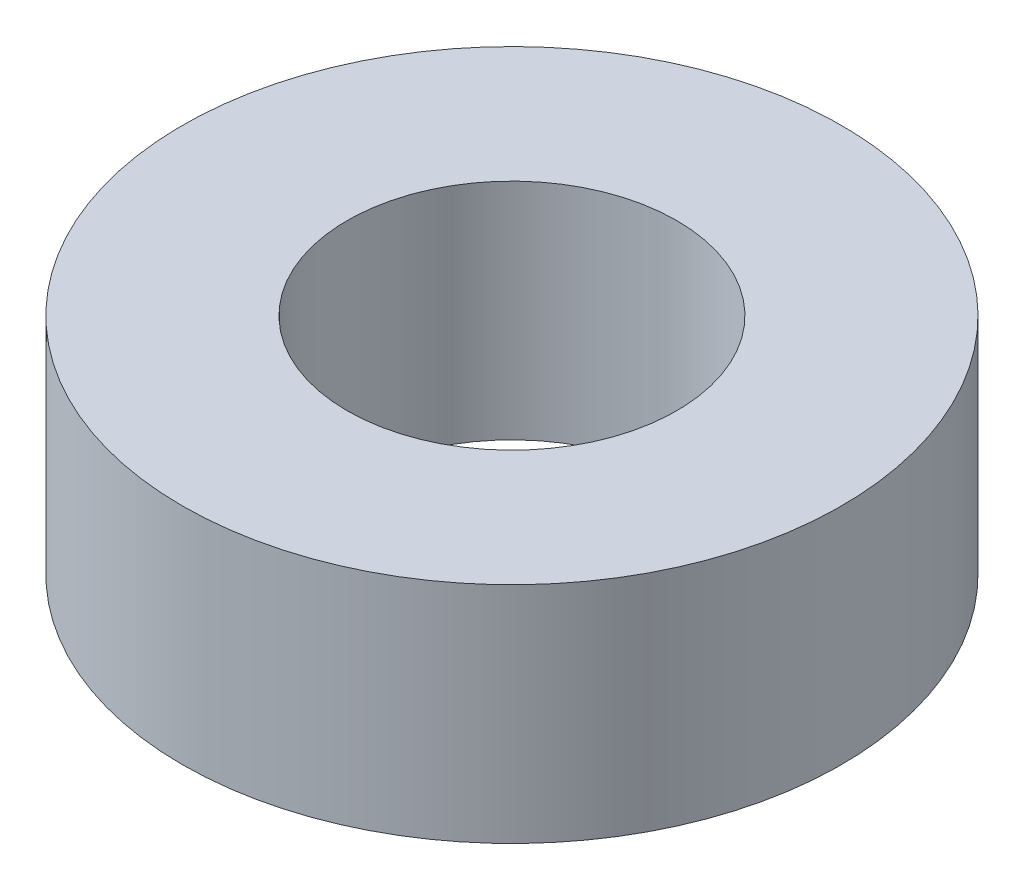
from build123d import *

# Parameters (mm, degrees)
SKETCH1_R           = 25
BOSS_EXTRUDE1_DEPTH = 17
SKETCH2_R           = 12.5
CUT_EXTRUDE1_DEPTH  = 40.230090492


with BuildPart() as part:
    # Sketch1 → Boss-Extrude1 (new body)
    with BuildSketch(Plane(origin=(0, 0, 0), x_dir=(1, 0, 0), z_dir=(0, 1, 0))):
        Circle(SKETCH1_R)
    extrude(amount=BOSS_EXTRUDE1_DEPTH)

    # Sketch2 → Cut-Extrude1 (cut, through all)
    with BuildSketch(Plane(origin=(0, 0, 0), x_dir=(1, 0, 0), z_dir=(0, 1, 0))):
        Circle(SKETCH2_R)
    extrude(amount=CUT_EXTRUDE1_DEPTH, mode=Mode.SUBTRACT)


solid = part.part
